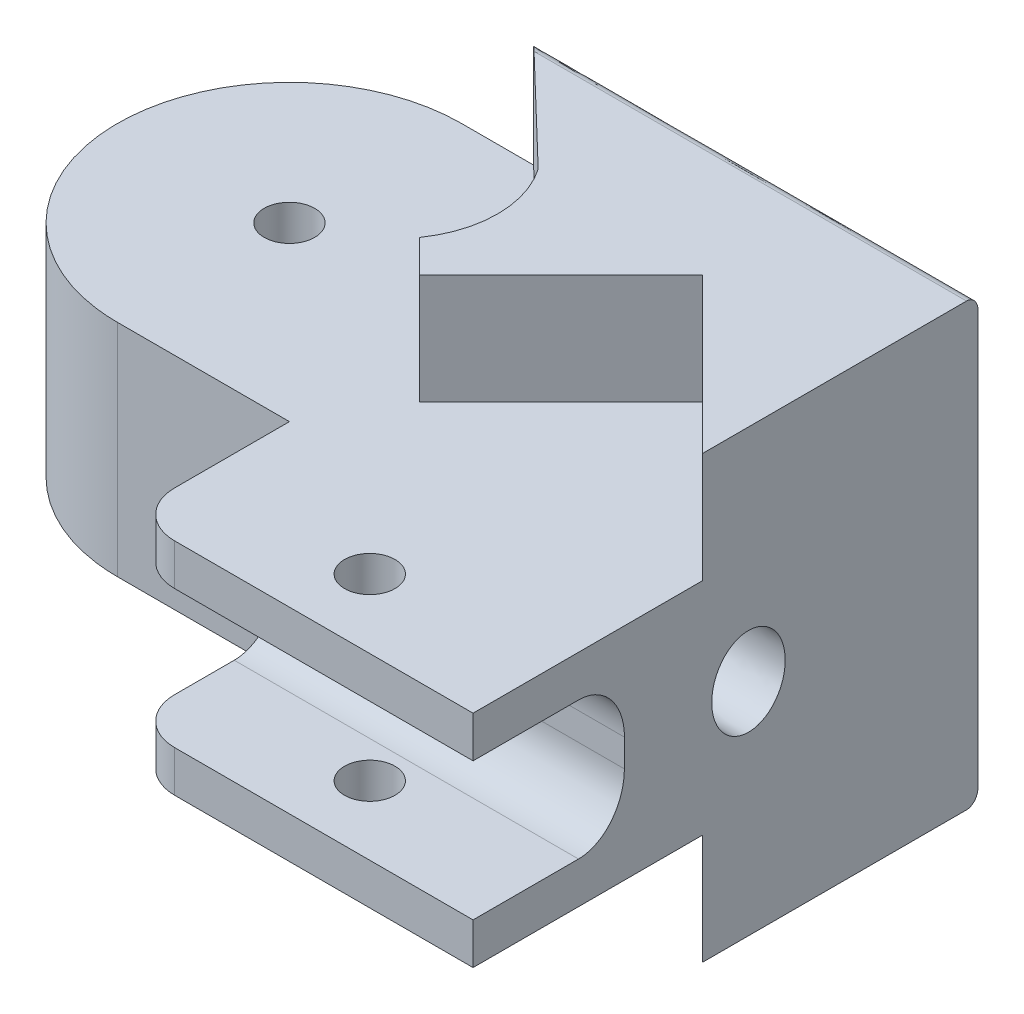
from build123d import *
from build123d.topology import SkipClean

# Parameters (mm, degrees)
BOSS_EXTRUDE1_DEPTH     = 16
CUT_EXTRUDE1_DEPTH      = 4
CUT_EXTRUDE3_DEPTH      = 30.681644331
FILLET2_R               = 0.5
FILLET3_R               = 0.5
FILLET5_R               = 0.5
SKETCH3_W               = 20
SKETCH3_H               = 1.6
CUT_EXTRUDE4_DEPTH      = 28.730849374
CUT_EXTRUDE4_DEPTH_BACK = 28.730849374
SKETCH7_R               = 1.1
SKETCH8_W               = 15
SKETCH8_H               = 1.5
BOSS_EXTRUDE2_DEPTH     = 2
CUT_EXTRUDE5_DEPTH      = 28.730849374
CUT_EXTRUDE5_DEPTH_BACK = 28.730849374
SKETCH9_R               = 1.1
FILLET6_R               = 2
SCALE1_START            = -5
SCALE1_OUTLINE_W        = 0.8
SCALE1_OUTLINE_H        = 7
SCALE1_DEPTH            = 20
SCALE1_START_2          = -15.0000001
SCALE1_2_OUTLINE_W      = 0.8
SCALE1_2_OUTLINE_H      = 15
SCALE1_2_DEPTH          = 11.381555588
SCALE1_START_3          = -14.999722138
SCALE1_3_OUTLINE_W      = 2.4
SCALE1_3_OUTLINE_H      = 15
SCALE1_3_DEPTH          = 29.999722138
SCALE1_4_DEPTH          = 15
SCALE1_5_DEPTH          = 5
SCALE1_START_4          = 4
SCALE1_6_DEPTH          = 0.8
SCALE1_START_5          = 5.5
SCALE1_7_OUTLINE_R      = 1.1
SCALE1_7_DEPTH          = 10
SCALE1_START_6          = 14.4
SCALE1_8_DEPTH          = 4.8
SCALE1_9_DEPTH          = 0.8
SCALE1_START_7          = 12
SCALE1_10_DEPTH         = 2.4
SCALE1_11_DEPTH         = 21


with BuildPart() as part:
    # Sketch1 → Boss-Extrude1 (new body)
    with BuildSketch(Plane(origin=(0, 0, 0), x_dir=(1, 0, 0), z_dir=(0, 1, 0))):
        with BuildLine():
            Line((0, 0), (15, 0))
            Line((15, 0), (15, 20))
            Line((15, 20), (-7.5, 20))
            ThreePointArc((-7.5, 20), (-15, 12.5), (-7.5, 5))
            Line((-7.5, 5), (0, 5))
            Line((0, 5), (0, 0))
        make_face()
    extrude(amount=BOSS_EXTRUDE1_DEPTH)

    # Sketch4 → Cut-Extrude1 (cut)
    with BuildSketch(Plane(origin=(0, 0, 0), x_dir=(1, 0, 0), z_dir=(0, 1, 0))):
        with BuildLine():
            Line((0.686184199, 15.151610139), (-2.137212345, 17.862787655))
            Line((-2.137212345, 17.862787655), (-4.362886582, 20))
            Line((-4.362886582, 20), (-7.5, 20))
            add(Edge.make_bspline(
                [(-7.5, 20), (-15, 20), (-15, 12.5), (-15, 5), (-7.5, 5)],
                knots=[4.71238898, 4.71238898, 4.71238898, 6.283185307, 6.283185307, 7.853981634, 7.853981634, 7.853981634], degree=2, weights=[1, 0.707106781, 1, 0.707106781, 1]))
            Line((-7.5, 5), (0, 5))
            Line((0, 5), (0, 0))
            Line((0, 0), (15, 0))
            Line((15, 0), (15, 8))
            Line((15, 8), (8.262594556, 14.737405444))
            Line((8.262594556, 14.737405444), (2.100397762, 8.575208649))
            Line((2.100397762, 8.575208649), (0.686184199, 9.989422212))
            ThreePointArc((0.686184199, 9.989422212), (1.5, 12.570516175), (0.686184199, 15.151610139))
        make_face()
    cut_extrude1 = extrude(amount=CUT_EXTRUDE1_DEPTH, mode=Mode.SUBTRACT)

    # Sketch6 → Cut-Extrude3 (cut, through all)
    with BuildSketch(Plane(origin=(0, 0, 0), x_dir=(0, 0, -1), z_dir=(1, 0, 0))):
        Polygon((0, 10), (0, 10.5), (4.59413535, 10.5), (4.59413535, 5.5), (0, 5.5), align=None)
    extrude(amount=CUT_EXTRUDE3_DEPTH, mode=Mode.SUBTRACT)

    # Fillet2
    fillet2_edges = [part.edges().sort_by_distance(p)[0] for p in [
        (5.318556709, 0, -20),
    ]]
    fillet(fillet2_edges, radius=FILLET2_R)

    # Fillet3
    fillet3_edges = [part.edges().sort_by_distance(p)[0] for p in [
        (3.75, 16, -20),
        (-15, 16, -12.5),
        (-3.75, 16, -5),
    ]]
    fillet(fillet3_edges, radius=FILLET3_R)

    # Fillet5
    # the kernel refuses this fillet: 0.5 mm, written as the material it takes off along each edge
    with BuildSketch(Plane(origin=(-4.362886582, -2.60646192, -20), x_dir=(0.7212958259123277, 0, 0.6926271230044727), z_dir=(0, 1, 0))) as fillet5_piece_1:
        with BuildLine():
            CenterArc((FILLET5_R * 2.48516953602, FILLET5_R), FILLET5_R, 133.838429889, 136.161570111)
            Line((FILLET5_R * 1.79254241302, FILLET5_R * 1.72129582591), (0, 0))
            Line((0, 0), (FILLET5_R * 2.48516953602, 0))
        make_face()
    extrude(amount=6.60646192, mode=Mode.SUBTRACT)

    # Sketch3 → slot_M3_pin_to_finger_top (revolve, cut)
    with BuildSketch(Plane(origin=(0, 8, 0), x_dir=(1, 0, 0), z_dir=(0, 1, 0)), mode=Mode.PRIVATE) as slot_m3_pin_to_finger_top_sk:
        with Locations((5, 10.8)):
            Rectangle(SKETCH3_W, SKETCH3_H)
    revolve(slot_m3_pin_to_finger_top_sk.sketch.rotate(Axis((15, 8, -10), (1, 0, 0)), 180), axis=Axis((15, 8, -10), (1, 0, 0)), mode=Mode.SUBTRACT)

    # Mirror1: Cut-Extrude1 across plane
    add(cut_extrude1.mirror(Plane.ZX.offset(8)), mode=Mode.SUBTRACT)

    # Sketch7 → Cut-Extrude4 (cut, two sides: drawn at the far end of the back side and taken through both)
    with BuildSketch(Plane(origin=(0, 12, 0), x_dir=(1, 0, 0), z_dir=(0, 1, 0)).offset(-CUT_EXTRUDE4_DEPTH_BACK)):
        with Locations(Location((-7.5, 12.5, 0), (0, 0, 270))):
            Circle(SKETCH7_R)
    extrude(amount=CUT_EXTRUDE4_DEPTH + CUT_EXTRUDE4_DEPTH_BACK, mode=Mode.SUBTRACT)

    # Sketch8 → Boss-Extrude2 (add)
    with BuildSketch(Plane.XY):
        with Locations((7.5, 11.25)):
            Rectangle(SKETCH8_W, SKETCH8_H)
        with Locations((7.5, 4.75)):
            Rectangle(SKETCH8_W, SKETCH8_H)
    extrude(amount=BOSS_EXTRUDE2_DEPTH)

    # Sketch9 → Cut-Extrude5 (cut, two sides: drawn at the far end of the back side and taken through both)
    with BuildSketch(Plane.XZ.offset(-4).offset(-CUT_EXTRUDE5_DEPTH_BACK)):
        with Locations(Location((7.5, -1, 0), (0, 0, 270))):
            Circle(SKETCH9_R)
    extrude(amount=CUT_EXTRUDE5_DEPTH + CUT_EXTRUDE5_DEPTH_BACK, mode=Mode.SUBTRACT)

    # Fillet6
    fillet6_edges = [part.edges().sort_by_distance(p)[0] for p in [
        (0, 11.25, 2),
        (0, 4.75, 2),
        (7.5, 5.5, -4.59413535),
        (7.5, 10.5, -4.59413535),
    ]]
    fillet(fillet6_edges, radius=FILLET6_R)

    # Scale1: read off the stored shape, not the designer's step
    # Scale1 outline → Scale1 (cut)
    with BuildSketch(Plane.YZ.offset(SCALE1_START)):
        with BuildLine():
            add(Edge.make_bspline(
                [(9.6, -8.4), (10.88, -8.4), (11.52, -9.2), (11.52, -10), (11.52, -11.127905424), (10.373644039, -12.125291287), (8.727272727, -11.425157669)],
                knots=[0.25, 0.25, 0.25, 0.25, 0.5, 0.5, 0.5, 0.810102051, 0.810102051, 0.810102051, 0.810102051], degree=3, weights=[0.5, 0.5, 0.666666667, 1, 0.586530598, 0.429496616, 0.528898053]))
            add(Edge.make_bspline(
                [(8.727272727, -8.574842331), (8.99618766, -8.460483934), (9.292277497, -8.4), (9.6, -8.4)],
                knots=[1.189897949, 1.189897949, 1.189897949, 1.189897949, 1.25, 1.25, 1.25, 1.25], degree=3, weights=[0.528898053, 0.509632684, 0.5, 0.5]))
            ThreePointArc((8.727272727, -8.574842331), (9.364484585, -9.164427251), (9.6, -10))
            ThreePointArc((9.6, -10), (9.364484585, -10.835572749), (8.727272727, -11.425157669))
        make_face()
        with BuildLine():
            Line((9, -4.59413535), (10.2, -4.59413535))
            add(Edge.make_bspline(
                [(10.2, -4.59413535), (10.922265967, -4.59413535), (11.5526523, -4.339714849), (12, -3.917011006)],
                knots=[0.75, 0.75, 0.75, 0.75, 0.862854057, 0.862854057, 0.862854057, 0.862854057], degree=3, weights=[0.5, 0.5, 0.533962769, 0.601888306]))
            Line((12, -3.917011006), (12, 2))
            Line((12, 2), (10.5, 2))
            Line((10.5, 2), (10.5, -2.59413535))
            ThreePointArc((10.5, -2.59413535), (9.992405014, -3.925573397), (8.727272727, -4.581180168))
            add(Edge.make_bspline(
                [(8.727272727, -4.581180168), (8.817788387, -4.589807611), (8.908795516, -4.59413535), (9, -4.59413535)],
                knots=[0.735749299, 0.735749299, 0.735749299, 0.735749299, 0.75, 0.75, 0.75, 0.75], degree=3, weights=[0.50162466, 0.500541553, 0.5, 0.5]))
        make_face()
        with Locations((4.4, -1.5)):
            Rectangle(SCALE1_OUTLINE_W, SCALE1_OUTLINE_H)
    extrude(amount=SCALE1_DEPTH, mode=Mode.SUBTRACT)

    # Scale1 2 outline → Scale1 2 (cut)
    with BuildSketch(Plane.YZ.offset(SCALE1_START_2)):
        with Locations((4.4, -12.5)):
            Rectangle(SCALE1_2_OUTLINE_W, SCALE1_2_OUTLINE_H)
    extrude(amount=SCALE1_2_DEPTH, mode=Mode.SUBTRACT)

    # Scale1 3 outline → Scale1 3 (add)
    with BuildSketch(Plane.YZ.offset(SCALE1_START_3)):
        with Locations((13.2, -12.5)):
            Rectangle(SCALE1_3_OUTLINE_W, SCALE1_3_OUTLINE_H)
    extrude(amount=SCALE1_3_DEPTH)

    # Scale1 4 outline → Scale1 4 (add)
    with BuildSketch(Plane.YZ):
        with BuildLine():
            ThreePointArc((8.727272727, -8.574842331), (6.4, -10), (8.727272727, -11.425157669))
            add(Edge.make_bspline(
                [(8.727272727, -11.425157669), (7.993060841, -11.112927724), (7.68, -10.542466711), (7.68, -10), (7.68, -9.457533289), (7.993060841, -8.887072276), (8.727272727, -8.574842331)],
                knots=[0.810102051, 0.810102051, 0.810102051, 0.810102051, 1, 1, 1, 1.189897949, 1.189897949, 1.189897949, 1.189897949], degree=3, weights=[0.528898053, 0.589768753, 0.746802735, 1, 0.746802735, 0.589768753, 0.528898053]))
        make_face()
        with BuildLine():
            add(Edge.make_bspline(
                [(12, -3.917011006), (12.42412108, -3.516254254), (12.6, -3.04170012), (12.6, -2.59413535)],
                knots=[0.862854057, 0.862854057, 0.862854057, 0.862854057, 1, 1, 1, 1], degree=3, weights=[0.601888306, 0.684434845, 0.817138743, 1]))
            Line((12, -3.917011006), (12, -5))
            Line((12, -5), (14.4, -5))
            Line((14.4, -5), (14.4, 2))
            Line((14.4, 2), (12.6, 2))
            Line((12.6, 2), (12.6, -2.59413535))
        make_face()
        with BuildLine():
            ThreePointArc((8.5, -4.59413535), (8.613820834, -4.590893928), (8.727272727, -4.581180168))
            add(Edge.make_bspline(
                [(6.6, -2.59413535), (6.6, -3.511000603), (7.284635991, -4.443676145), (8.727272727, -4.581180168)],
                knots=[0.5, 0.5, 0.5, 0.5, 0.735749299, 0.735749299, 0.735749299, 0.735749299], degree=3, weights=[1, 0.685667601, 0.519542487, 0.50162466]))
            Line((6.6, -2.59413535), (6.6, 2))
            Line((6.6, 2), (5.5, 2))
            Line((5.5, 2), (5.5, -2.59413535))
            ThreePointArc((5.5, -2.59413535), (6.085786438, -4.008348912), (7.5, -4.59413535))
            Line((7.5, -4.59413535), (8.5, -4.59413535))
        make_face()
    extrude(amount=SCALE1_4_DEPTH)

    # Scale1 5 outline → Scale1 5 (add)
    with BuildSketch(Plane.YZ.offset(SCALE1_START)):
        with BuildLine():
            ThreePointArc((8.727272727, -8.574842331), (6.4, -10), (8.727272727, -11.425157669))
            add(Edge.make_bspline(
                [(8.727272727, -11.425157669), (7.993060841, -11.112927724), (7.68, -10.542466711), (7.68, -10), (7.68, -9.457533289), (7.993060841, -8.887072276), (8.727272727, -8.574842331)],
                knots=[0.810102051, 0.810102051, 0.810102051, 0.810102051, 1, 1, 1, 1.189897949, 1.189897949, 1.189897949, 1.189897949], degree=3, weights=[0.528898053, 0.589768753, 0.746802735, 1, 0.746802735, 0.589768753, 0.528898053]))
        make_face()
    extrude(amount=SCALE1_5_DEPTH)

    # Scale1 6 outline → Scale1 6 (cut)
    with BuildSketch(Plane(origin=(0, 0, 0), x_dir=(1, 0, 0), z_dir=(0, 1, 0)).offset(SCALE1_START_4)):
        with BuildLine():
            Line((15, 5), (15, 8))
            Line((15, 8), (8.262594556, 14.737405444))
            Line((8.262594556, 14.737405444), (2.100397762, 8.575208649))
            Line((2.100397762, 8.575208649), (0.686184199, 9.989422212))
            ThreePointArc((0.686184199, 9.989422212), (1.5, 12.570516175), (0.686184199, 15.151610139))
            Line((0.686184199, 15.151610139), (-3.466615376, 19.139352087))
            ThreePointArc((-3.466615376, 19.139352087), (-3.571403452, 19.284344458), (-3.618444512, 19.456943609))
            Line((-3.618444512, 19.456943609), (-3.618444512, 5))
            Line((-3.618444512, 5), (15, 5))
        make_face()
        with BuildLine():
            ThreePointArc((-3.618444512, 19.543056391), (-3.458289835, 19.8684618), (-3.120301814, 20))
            Line((-3.120301814, 20), (-3.618444512, 20))
            Line((-3.618444512, 20), (-3.618444512, 19.543056391))
        make_face()
    extrude(amount=SCALE1_6_DEPTH, mode=Mode.SUBTRACT)

    # Scale1 7 outline → Scale1 7 (cut)
    with SkipClean():  # the faces are left unmerged after this step: merging them gives an invalid solid
        with BuildSketch(Plane(origin=(0, 0, 0), x_dir=(1, 0, 0), z_dir=(0, 1, 0)).offset(SCALE1_START_5)):
            with BuildLine():
                Line((0, -2), (2, -2))
                ThreePointArc((2, -2), (0.585786438, -1.414213562), (0, 0))
                Line((0, 0), (0, -2))
            make_face()
            with BuildLine():
                ThreePointArc((-14.999722138, 12.564558909), (-12.780426506, 17.826076972), (-7.5, 20))
                Line((-7.5, 20), (-14.999722138, 20))
                Line((-14.999722138, 20), (-14.999722138, 12.564558909))
            make_face()
            with BuildLine():
                Line((-14.999722138, 5), (-7.5, 5))
                ThreePointArc((-7.5, 5), (-12.780426506, 7.173923028), (-14.999722138, 12.435441091))
                Line((-14.999722138, 12.435441091), (-14.999722138, 5))
            make_face()
            with Locations((-7.5, 12.5)):
                Circle(SCALE1_7_OUTLINE_R)
            with Locations((7.5, 1)):
                Circle(SCALE1_7_OUTLINE_R)
        extrude(amount=SCALE1_7_DEPTH, mode=Mode.SUBTRACT)

    # Scale1 8 outline → Scale1 8 (add)
    with SkipClean():  # the faces are left unmerged after this step: merging them gives an invalid solid
        with BuildSketch(Plane(origin=(0, 0, 0), x_dir=(1, 0, 0), z_dir=(0, 1, 0)).offset(SCALE1_START_6)):
            with BuildLine():
                Line((15, 8), (15, 20))
                Line((15, 20), (-4.362886582, 20))
                Line((-4.362886582, 20), (-3.466615376, 19.139352087))
                Line((-3.466615376, 19.139352087), (0.686184199, 15.151610139))
                ThreePointArc((0.686184199, 15.151610139), (1.5, 12.570516175), (0.686184199, 9.989422212))
                Line((0.686184199, 9.989422212), (2.100397762, 8.575208649))
                Line((2.100397762, 8.575208649), (8.262594556, 14.737405444))
                Line((8.262594556, 14.737405444), (15, 8))
            make_face()
        extrude(amount=SCALE1_8_DEPTH)

    # Scale1 9 outline → Scale1 9 (add)
    with SkipClean():  # the faces are left unmerged after this step: merging them gives an invalid solid
        with BuildSketch(Plane(origin=(0, 0, 0), x_dir=(1, 0, 0), z_dir=(0, 1, 0)).offset(SCALE1_START_4)):
            with BuildLine():
                Line((-3.618444512, 19.456943609), (-3.618444512, 19.543056391))
                ThreePointArc((-3.618444512, 19.543056391), (-3.620301814, 19.5), (-3.618444512, 19.456943609))
            make_face()
        extrude(amount=SCALE1_9_DEPTH)

    # Scale1 10 outline → Scale1 10 (add)
    with SkipClean():  # the faces are left unmerged after this step: merging them gives an invalid solid
        with BuildSketch(Plane(origin=(0, 0, 0), x_dir=(1, 0, 0), z_dir=(0, 1, 0)).offset(SCALE1_START_7)):
            with BuildLine():
                Line((-14.999722138, 12.435441091), (-14.999722138, 12.564558909))
                ThreePointArc((-14.999722138, 12.564558909), (-15, 12.5), (-14.999722138, 12.435441091))
            make_face()
        extrude(amount=SCALE1_10_DEPTH)

    # Scale1 11 outline → Scale1 11 (cut)
    with SkipClean():  # the faces are left unmerged after this step: merging them gives an invalid solid
        with BuildSketch(Plane.YZ.offset(SCALE1_START)):
            with BuildLine():
                Line((0.5, -20), (0.6, -20))
                add(Edge.make_bspline(
                    [(0.6, -20), (0.3, -20), (0, -19.833333333), (0, -19.5)],
                    knots=[0, 0, 0, 0, 0.25, 0.25, 0.25, 0.25], degree=3, weights=[1, 0.666666667, 0.5, 0.5]))
                ThreePointArc((0, -19.5), (0.146446609, -19.853553391), (0.5, -20))
            make_face()
            with BuildLine():
                add(Edge.make_bspline(
                    [(18.6, -20), (18.9, -20), (19.2, -19.833333333), (19.2, -19.5)],
                    knots=[0.5, 0.5, 0.5, 0.5, 0.75, 0.75, 0.75, 0.75], degree=3, weights=[1, 0.666666667, 0.5, 0.5]))
                Line((18.6, -20), (19.2, -20))
                Line((19.2, -20), (19.2, -19.5))
            make_face()
        extrude(amount=SCALE1_11_DEPTH, mode=Mode.SUBTRACT)


solid = part.part
